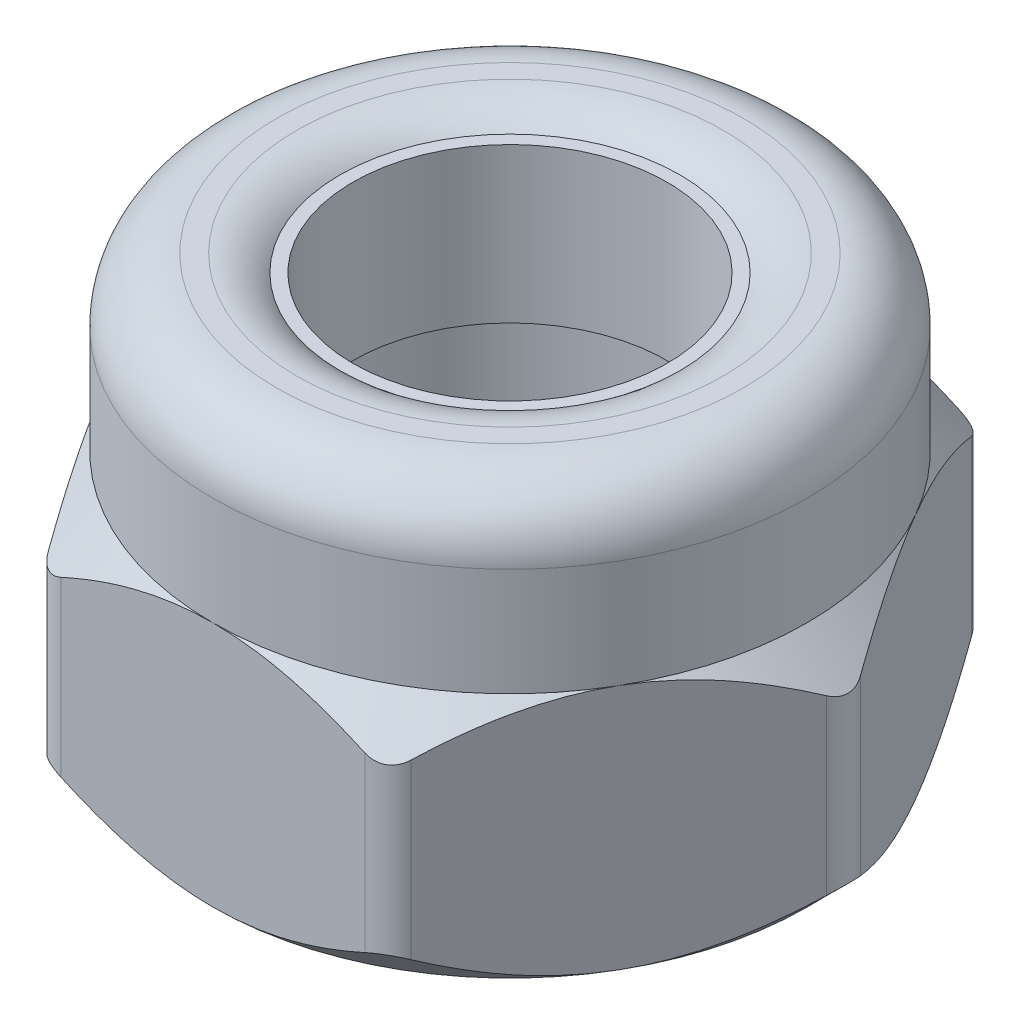
from build123d import *

# Parameters (mm, degrees)
EXTRUDE_1_DEPTH     = 1.45
SKETCH_3_R          = 3.5
EXTRUDE_2_DEPTH     = 2.02
SKETCH_4_R          = 2
CUT_EXTRUDE_1_DEPTH = 8.265654364
EXTRUDE_START       = -0.2
SKETCH_5_R          = 2
SKETCH_5_R_2        = 1.85
EXTRUDE_3_DEPTH     = 1.82
FILLET_1_R          = 0.75
FILLET_3_R          = 0.4


with BuildPart() as part:
    # 草图1 → 凸台-拉伸1 (new, symmetric)
    with BuildSketch(Plane(origin=(0, 0, 0), x_dir=(1, 0, 0), z_dir=(0, 1, 0))):
        Polygon((4.041451884, 0), (2.020725942, 3.5), (-2.020725942, 3.5), (-4.041451884, 0), (-2.020725942, -3.5), (2.020725942, -3.5), align=None)
    extrude(amount=EXTRUDE_1_DEPTH, both=True)

    # 草图3 → 凸台-拉伸2 (add)
    with BuildSketch(Plane(origin=(0, 1.45, 0), x_dir=(1, 0, 0), z_dir=(0, 1, 0))):
        with Locations(Location((0, 0, 0), (0, 0, 270))):
            Circle(SKETCH_3_R)
    extrude(amount=EXTRUDE_2_DEPTH)

    # 草图4 → 切除-拉伸1 (cut, through all)
    with BuildSketch(Plane(origin=(0, 3.47, 0), x_dir=(1, 0, 0), z_dir=(0, 1, 0))):
        with Locations(Location((0, 0, 0), (0, 0, 270))):
            Circle(SKETCH_4_R)
    extrude(amount=-CUT_EXTRUDE_1_DEPTH, mode=Mode.SUBTRACT)

    # 草图5 → 凸台-拉伸3 (add)
    with BuildSketch(Plane(origin=(0, 3.47, 0), x_dir=(1, 0, 0), z_dir=(0, 1, 0)).offset(EXTRUDE_START)):
        with Locations(Location((0, 0, 0), (0, 0, 270))):
            Circle(SKETCH_5_R)
        with Locations(Location((0, 0, 0), (0, 0, 270))):
            Circle(SKETCH_5_R_2, mode=Mode.SUBTRACT)
    extrude(amount=-EXTRUDE_3_DEPTH)

    # 圆角1
    # the kernel refuses this fillet: 0.75 mm, written as the material it takes off along each edge
    with BuildSketch(Plane(origin=(0, 3.47, 0), x_dir=(0, 0, 1), z_dir=(-1, 0, 0))) as fillet_1_piece_1:
        with BuildLine():
            CenterArc((3.5 - FILLET_1_R, -FILLET_1_R), FILLET_1_R, 0, 90)
            Line((3.5 - FILLET_1_R, 0), (3.5 - FILLET_1_R, FILLET_1_R * 0.02))
            Line((3.5 - FILLET_1_R, FILLET_1_R * 0.02), (3.5 + FILLET_1_R * 0.02, FILLET_1_R * 0.02))
            Line((3.5 + FILLET_1_R * 0.02, FILLET_1_R * 0.02), (3.5 + FILLET_1_R * 0.02, -FILLET_1_R))
            Line((3.5 + FILLET_1_R * 0.02, -FILLET_1_R), (3.5, -FILLET_1_R))
        make_face()
    revolve(axis=Axis((0, 3.47, 0), (0, 1, 0)), mode=Mode.SUBTRACT)
    with BuildSketch(Plane(origin=(0, 3.47, 0), x_dir=(0, 0, 1), z_dir=(-1, 0, 0))) as fillet_1_piece_2:
        with BuildLine():
            CenterArc((2.509901951, -0.75), FILLET_1_R, 90, 42.833428066)
            Line((2, -0.2), (1.989801961, -0.189))
            ThreePointArc((1.989801961, -0.189), (1.985, -0.1), (1.985, 0))
            Line((1.985, 0), (2, 0.015))
            Line((2, 0.015), (2.509901951, 0.015))
            Line((2.509901951, 0.015), (2.509901951, 0))
        make_face()
    revolve(axis=Axis((0, 3.47, 0), (0, 1, 0)), mode=Mode.SUBTRACT)

    # 草图6 → 切除-旋转1 (revolve, cut)
    with BuildSketch(Plane.XY):
        Polygon((-4.041451884, 1.45), (-4.041451884, 0.908548116), (-3.5, 1.45), align=None)
        Polygon((-4.041451884, -1.45), (-4.041451884, -0.908548116), (-3.5, -1.45), align=None)
    revolve(axis=Axis((0, -1000, 0), (0, 1, 0)), mode=Mode.SUBTRACT)

    # 圆角3
    fillet_3_edges = [part.edges().sort_by_distance(p)[0] for p in [
        (-4.041451884, 0, 0),
        (-2.020725942, 0, -3.5),
        (2.020725942, 0, -3.5),
        (4.041451884, 0, 0),
        (2.020725942, 0, 3.5),
        (-2.020725942, 0, 3.5),
    ]]
    fillet(fillet_3_edges, radius=FILLET_3_R)


solid = part.part
